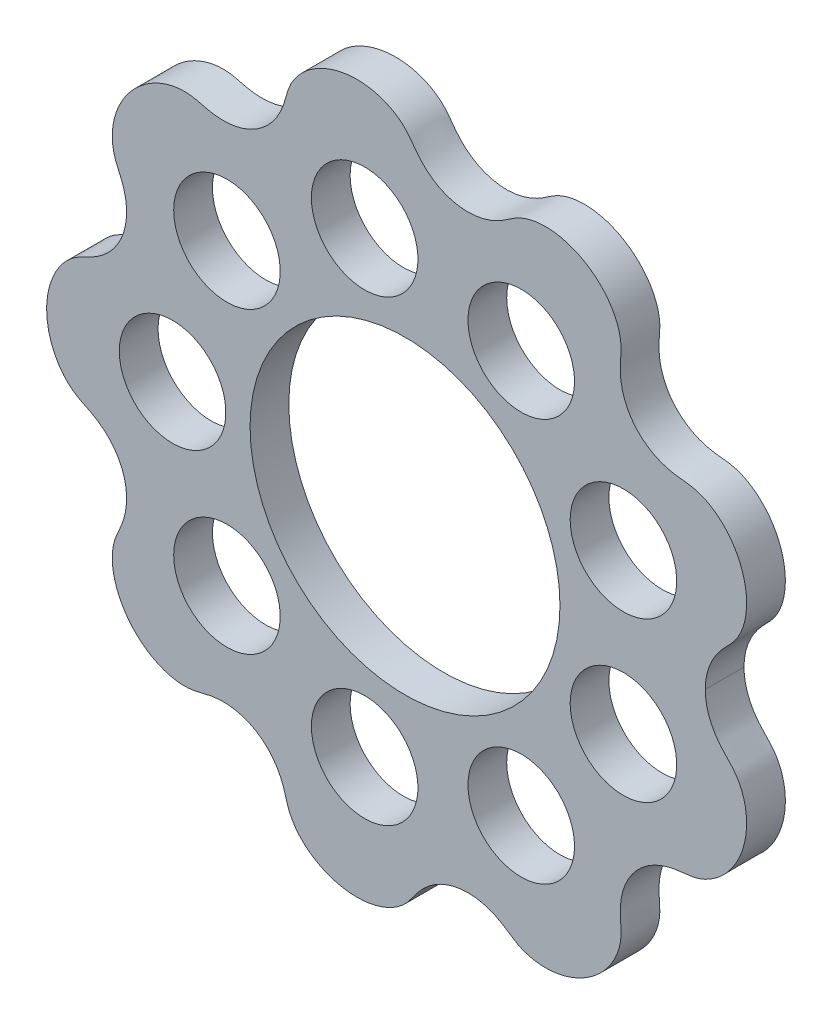
from build123d import *

# Parameters (mm, degrees)
BOSS_EXTRUDE1_DEPTH = 25.4
SKETCH7_R           = 101.6
SKETCH7_R_2         = 34.925
CUT_EXTRUDE1_DEPTH  = 25.4


# Read off the part's stored shape, not the designer's step: Boss-Extrude1
with BuildPart() as part:
    # Boss-Extrude1 outline → Boss-Extrude1 (new body)
    with BuildSketch(Plane.XY):
        with BuildLine():
            add(Edge.make_bspline(
                [(-234.95, 0), (-234.95, -0.220380814), (-234.947590154, -0.544101206), (-234.939557298, -1.173634251), (-234.917868443, -1.91226702), (-234.886540038, -2.647513455), (-234.835931347, -3.560918281), (-234.758812439, -4.554232427), (-234.66240931, -5.575608828), (-234.546722938, -6.57781084), (-234.366267376, -7.92565393), (-234.093541377, -9.600599485), (-233.692246689, -11.603252575), (-233.117303463, -13.915435499), (-232.435862893, -16.199670032), (-231.647877023, -18.448777696), (-230.753201881, -20.657971423), (-229.751815959, -22.820831559), (-228.607728174, -24.998982932), (-227.309240126, -27.179170322), (-225.843658283, -29.344362379), (-224.198718625, -31.475309557), (-221.895502812, -34.083333593), (-219.307150866, -36.502221099), (-216.42131401, -38.658386082), (-212.959565054, -40.660874881), (-209.699147786, -42.209916176), (-206.135389451, -43.92194884), (-202.392724366, -46.045884891), (-198.624789727, -48.640215141), (-194.940225701, -51.792932901), (-191.465795803, -55.562408034), (-188.352803631, -59.976657164), (-185.90367834, -64.657243151), (-184.118738866, -69.501261319), (-182.979459938, -74.409236131), (-182.451431228, -79.296475214), (-182.513191472, -84.659896283), (-183.339948185, -90.417427736), (-184.850125286, -95.641782664), (-186.773705134, -100.304517919), (-188.548098426, -104.122715792), (-189.87011621, -107.240720514), (-190.995728956, -110.838424894), (-191.766448398, -114.917229844), (-192.086281189, -119.768223701), (-191.722634556, -125.327453856), (-190.646015176, -130.794130874), (-188.926233428, -136.088256778), (-186.293506027, -141.987839158), (-182.470856407, -148.289867044), (-177.722742446, -153.948448907), (-172.180252675, -158.80735955), (-166.827466507, -162.424541638), (-161.912407268, -165.037511346), (-156.715734302, -167.047052972), (-151.304107991, -168.370525163), (-146.47127314, -168.897917622), (-142.320600557, -168.84718414), (-138.582092476, -168.363406872), (-135.281891882, -167.602909189), (-131.213579664, -166.518496327), (-126.28765785, -165.433814904), (-120.880429877, -164.853781334), (-115.066807698, -165.039368665), (-109.774138568, -165.909896531), (-105.052848436, -167.27856093), (-100.529470416, -169.205005773), (-96.271060841, -171.663544728), (-92.341132782, -174.61774194), (-88.794988811, -178.022115965), (-85.395117397, -182.170497339), (-82.769632774, -186.399187645), (-80.810250686, -190.541059196), (-79.366128397, -194.480551684), (-78.509646724, -197.296702824), (-77.836042344, -199.73393124), (-77.136746563, -202.173489139), (-76.352173546, -204.588409477), (-75.066111769, -207.67689429), (-73.033988897, -211.296775833), (-70.161261743, -215.218480281), (-66.309018081, -219.243322938), (-61.970542416, -222.739020294), (-57.250018924, -225.689092438), (-51.441085443, -228.516152434), (-44.461916439, -230.886637694), (-35.974888842, -232.383104234), (-27.025092624, -232.304217862), (-19.110063195, -230.898329878), (-12.675498259, -228.700349948), (-7.679059731, -226.23578481), (-3.638240286, -223.533114008), (-0.490614066, -220.826570841), (1.774211393, -218.364194696), (3.337445492, -216.36326664), (4.8288816, -214.309976931), (6.295587765, -212.250175367), (8.063341469, -209.896692496), (10.228399237, -207.329031436), (12.556213731, -204.919941341), (15.345867473, -202.429451623), (18.660528866, -199.963341936), (22.552917091, -197.655770957), (27.049453338, -195.669514548), (31.752841034, -194.237618222), (36.595265683, -193.383793204), (41.504758318, -193.120623175), (46.40941607, -193.449270035), (51.680645069, -194.441444297), (57.207131303, -196.255422708), (62.089885079, -198.649858729), (66.347751494, -201.353889083), (69.799825007, -203.7643493), (72.640893008, -205.60771802), (75.988479884, -207.340965318), (79.871484917, -208.808252527), (84.593241882, -209.965592984), (90.131163367, -210.572820556), (95.701738849, -210.461836881), (101.214077571, -209.687496351), (107.481190909, -208.119220154), (114.351291298, -205.448976142), (120.748376372, -201.755607184), (126.495956475, -197.141050047), (130.987623936, -192.497717887), (134.414501908, -188.111037789), (137.295721354, -183.3423145), (139.539080918, -178.24265142), (140.897247934, -173.574927561), (141.568761391, -169.478319851), (141.720917302, -166.136242006), (141.632262576, -163.598606153), (141.454933268, -161.067023712), (141.2544846, -158.546340167), (141.095870142, -155.607179788), (141.103941465, -152.248563689), (141.338616789, -148.906803936), (141.874759976, -145.205822954), (142.828752947, -141.186050243), (144.327217419, -136.916369279), (146.495022934, -132.504490881), (149.177621774, -128.384315276), (152.338306095, -124.617596834), (155.930033232, -121.260235828), (159.898469164, -118.359340735), (164.574222182, -115.73110957), (169.973759083, -113.568340874), (175.253279309, -112.264011476), (180.253111391, -111.598515413), (184.446967132, -111.226084546), (187.808245982, -110.811984321), (191.486756323, -109.987940219), (195.404464579, -108.616001876), (199.765464718, -106.46748596), (204.39807648, -103.37294736), (208.594046905, -99.70722303), (212.319005314, -95.57079503), (216.111826885, -90.340978276), (219.156475101, -84.793666901), (221.542108754, -78.731559419), (223.15508973, -72.239674436), (223.924979402, -66.644094285), (224.0832738, -60.846628215), (223.615846183, -55.696742755), (222.725196994, -51.247909792), (221.620192633, -47.583658394), (220.556844201, -44.808971953), (219.320513319, -42.189810589), (217.922795316, -39.739047012), (216.40502209, -37.523690695), (214.802636844, -35.54233819), (212.784617945, -33.350567501), (210.37413656, -30.93856682), (208.037205123, -28.452220755), (205.874647298, -25.811318759), (204.339886865, -23.678970834), (203.329191362, -22.137672175), (202.307284236, -20.441465826), (201.293416322, -18.581576948), (200.231424377, -16.349218244), (199.307286607, -14.013227431), (198.618668185, -11.925576805), (198.11547077, -10.109250026), (197.754243941, -8.57967147), (197.452128744, -7.037251128), (197.240023129, -5.678566253), (197.095834551, -4.508644285), (197.000866111, -3.531322991), (196.940041856, -2.748086006), (196.900103207, -2.058826903), (196.875371564, -1.481355606), (196.861100812, -0.978419678), (196.853488972, -0.556541751), (196.850634358, -0.255617983), (196.85, -0.08531086), (196.85, -1e-09)],
                knots=[0.066092855, 0.066092855, 0.066092855, 0.066092855, 0.066092855, 0.067201481, 0.067755795, 0.068310108, 0.069418734, 0.070527361, 0.071635988, 0.072744614, 0.073853241, 0.074961867, 0.077564671, 0.080167474, 0.082770277, 0.085373081, 0.087975884, 0.090578688, 0.093181491, 0.095784295, 0.09872305, 0.101661805, 0.10460056, 0.107539315, 0.113917987, 0.117107324, 0.12029666, 0.124992231, 0.129687803, 0.134383375, 0.139078947, 0.144956429, 0.150833912, 0.156724461, 0.162615011, 0.167973858, 0.173332706, 0.1786889, 0.184045095, 0.191358572, 0.198672049, 0.202368777, 0.206065506, 0.209762235, 0.213458964, 0.218810451, 0.224161939, 0.230949028, 0.237736117, 0.243086386, 0.248436655, 0.259137192, 0.26983773, 0.275187999, 0.280538268, 0.287325357, 0.294112446, 0.299463933, 0.304815421, 0.30851215, 0.312208879, 0.315905607, 0.319602336, 0.326915813, 0.33422929, 0.339585485, 0.344941679, 0.350300527, 0.355659374, 0.361018221, 0.366377069, 0.371733263, 0.377089458, 0.384402935, 0.388059673, 0.391716412, 0.39541314, 0.397261505, 0.399109869, 0.402806598, 0.406503327, 0.411854814, 0.417206302, 0.423993391, 0.43078048, 0.436130749, 0.441481018, 0.452181555, 0.462882093, 0.473582631, 0.48036972, 0.487156809, 0.492508297, 0.497859784, 0.501556513, 0.505253242, 0.507101606, 0.50894997, 0.512646699, 0.516303438, 0.519960176, 0.523616915, 0.527273653, 0.532629848, 0.537986042, 0.54334489, 0.548703737, 0.554062584, 0.559421432, 0.564777626, 0.570133821, 0.577447298, 0.584760775, 0.588457504, 0.592154232, 0.595850961, 0.59954769, 0.604899177, 0.610250665, 0.617037754, 0.623824843, 0.629175112, 0.634525381, 0.645225919, 0.655926456, 0.661276725, 0.666626994, 0.673414083, 0.680201172, 0.68555266, 0.690904147, 0.694600876, 0.698297605, 0.700145969, 0.701994333, 0.705691062, 0.709347801, 0.713004539, 0.716661278, 0.720318016, 0.725674211, 0.731030405, 0.736389253, 0.7417481, 0.747106947, 0.752465795, 0.757821989, 0.763178184, 0.770491661, 0.777805138, 0.781501867, 0.785198595, 0.788895324, 0.792592053, 0.797943541, 0.803295028, 0.810082117, 0.816869206, 0.822219475, 0.827569744, 0.838270282, 0.844429047, 0.850587812, 0.856746577, 0.862905342, 0.869720711, 0.873128396, 0.876536081, 0.879615122, 0.882694164, 0.885773205, 0.888852246, 0.891335996, 0.893819745, 0.898787243, 0.903754742, 0.906238491, 0.90872224, 0.910264391, 0.911806542, 0.914890845, 0.917975147, 0.921059449, 0.922776075, 0.924492702, 0.926209328, 0.927925955, 0.929642581, 0.930500894, 0.931359207, 0.932217521, 0.933075834, 0.93350499, 0.933934147, 0.934363303, 0.93479246, 0.93479246, 0.93479246, 0.93479246, 0.93479246], degree=4))
            add(Edge.make_bspline(
                [(196.85, -1e-09), (196.85, 0.077725435), (196.850526565, 0.233079521), (196.852896108, 0.502476398), (196.859214569, 0.88650284), (196.871060687, 1.350264945), (196.891590978, 1.877999563), (196.924746696, 2.502596989), (196.975245856, 3.21845277), (197.054102872, 4.108904321), (197.173853099, 5.176457153), (197.35006315, 6.416645175), (197.601177393, 7.826473024), (197.901611406, 9.226392944), (198.250684136, 10.614324008), (198.647729538, 11.988426064), (199.091997825, 13.34723341), (199.582654491, 14.689144816), (200.253204408, 16.344500352), (201.14756006, 18.292779542), (202.257411513, 20.391156432), (203.61416906, 22.612359137), (205.019979569, 24.648727281), (206.447192589, 26.511247314), (207.957990978, 28.306388856), (209.538466736, 30.040132835), (211.167921371, 31.727496869), (212.813150748, 33.399077613), (214.506527263, 35.202663705), (216.168477966, 37.206509241), (217.737306972, 39.443291707), (219.177191452, 41.913828444), (220.444755794, 44.546305145), (221.531444229, 47.325553325), (222.658475008, 50.979681553), (223.578225582, 55.428993282), (224.077265339, 60.604817222), (223.943873435, 66.454112842), (223.179991845, 72.127866747), (221.807569918, 77.685462367), (219.849708981, 83.064640827), (217.328691653, 88.204182218), (214.266840162, 93.04154278), (210.609169514, 97.608107153), (206.899927463, 101.252239606), (203.335395059, 104.069408956), (200.123211258, 106.144187642), (197.504292931, 107.574713564), (194.841159642, 108.776517921), (192.150112418, 109.743545884), (189.510545887, 110.448550463), (186.94936684, 110.915382998), (184.492849653, 111.208379183), (182.158046289, 111.431624706), (179.242006339, 111.737602666), (175.758094468, 112.240635761), (171.493181317, 113.181443556), (166.55509645, 114.857313992), (161.629279523, 117.255174871), (156.864323976, 120.453348678), (152.59075385, 124.28880432), (148.897684442, 128.690033054), (145.862595654, 133.56469793), (143.54043514, 138.812620149), (142.034362289, 144.079987021), (141.241441529, 149.23406313), (141.055521115, 153.597552226), (141.16510517, 157.115886428), (141.370140727, 160.040757694), (141.555721154, 162.378856327), (141.693745973, 164.848931751), (141.678749746, 167.452265353), (141.44281169, 170.174153697), (140.957770499, 172.992240513), (140.236672497, 175.823605956), (139.282649868, 178.651145253), (137.797181604, 182.174810293), (135.641785927, 186.174385782), (132.697119186, 190.46007304), (128.835078982, 194.855151085), (124.602893803, 198.710484937), (119.979203538, 202.085674476), (115.021726068, 204.947875427), (109.786881052, 207.264513887), (104.331971406, 209.00202684), (98.594702066, 210.149112744), (93.410854658, 210.556425319), (88.869422841, 210.423264986), (85.075105271, 209.947885719), (82.149373094, 209.360323903), (79.336789692, 208.56913037), (76.653734325, 207.580144955), (74.178540844, 206.423529133), (71.916489697, 205.134849446), (69.84635404, 203.780278734), (67.914291441, 202.450512053), (65.4837964, 200.810510419), (62.49162163, 198.956440743), (58.619769016, 196.935707996), (53.759747793, 195.045359463), (48.445037845, 193.715973377), (42.73912363, 193.103062263), (36.999995618, 193.294193818), (31.341885022, 194.291871376), (25.883497938, 196.075163849), (20.731320402, 198.602649497), (16.191803503, 201.669601651), (12.271414698, 205.108173374), (9.324194672, 208.331292611), (7.146599297, 211.096932247), (5.423594636, 213.469307943), (4.062856659, 215.379684207), (2.580855928, 217.360592403), (0.895977568, 219.345222254), (-1.034357571, 221.278651636), (-3.217351968, 223.125652914), (-5.589711711, 224.831091816), (-8.138042671, 226.383878658), (-11.540945608, 228.128322086), (-15.762952057, 229.80671303), (-20.773484319, 231.196944642), (-26.557080468, 232.081298164), (-32.277283238, 232.314259043), (-37.988765488, 231.92775342), (-43.626200864, 230.933721461), (-49.125431297, 229.343475965), (-54.420986316, 227.168139775), (-59.55332222, 224.359012913), (-63.786195197, 221.338919563), (-67.179539992, 218.317736728), (-69.780587979, 215.51463476), (-71.6441514, 213.183911904), (-73.290145886, 210.769928732), (-74.70977797, 208.287687205), (-75.862427862, 205.810644381), (-76.766912238, 203.369440017), (-77.482026884, 201.0011211), (-78.107315156, 198.740554823), (-78.915009646, 195.921948588), (-80.015375486, 192.578315947), (-81.682484693, 188.541565968), (-84.19038433, 183.969513554), (-87.407175447, 179.534915026), (-91.384187655, 175.397706914), (-95.903471772, 171.855081803), (-100.879130725, 168.982383767), (-106.206776125, 166.83988147), (-111.778209556, 165.464291923), (-117.227080095, 164.895768361), (-122.440543451, 165.009889773), (-126.770026085, 165.584505838), (-130.215879813, 166.303377387), (-133.060711661, 167.013196558), (-135.33106362, 167.601964168), (-137.739645289, 168.166816176), (-140.306032472, 168.604111912), (-143.027539429, 168.844409236), (-145.887039693, 168.856092551), (-148.800607686, 168.637611097), (-151.7508546, 168.189079261), (-155.478936107, 167.338056612), (-159.792029589, 165.909925233), (-164.523943641, 163.754196379), (-169.522886818, 160.714026537), (-174.05456073, 157.215609457), (-178.181368944, 153.248258949), (-181.86094356, 148.863112681), (-185.051408374, 144.110076771), (-187.70975972, 139.039755418), (-189.835685178, 133.588837467), (-191.136975415, 128.554473435), (-191.794449446, 124.058913123), (-191.985168589, 120.239691019), (-191.914581218, 117.256378249), (-191.623807675, 114.349134994), (-191.115754846, 111.535105751), (-190.406523455, 108.896671792), (-189.530222767, 106.445209405), (-188.555706312, 104.171305025), (-187.581640925, 102.037683236), (-186.388605636, 99.359329582), (-185.08228914, 96.090656849), (-183.764596014, 91.926729819), (-182.746899953, 86.812287658), (-182.360599924, 81.347474629), (-182.747821915, 75.621815168), (-183.93263887, 70.003067062), (-185.897680063, 64.604160755), (-188.601719278, 59.538364347), (-191.985472994, 54.903353203), (-195.794110067, 50.965372483), (-199.861210572, 47.701644791), (-203.547142692, 45.358888664), (-206.648901665, 43.694623729), (-209.284432003, 42.40975481), (-211.402075521, 41.401421506), (-213.610235121, 40.285919207), (-215.857291423, 38.971261484), (-218.096544715, 37.405994838), (-220.294562167, 35.576884418), (-222.386042444, 33.536726589), (-224.357760123, 31.2967269), (-226.197272225, 28.868105842), (-227.680571922, 26.587771333), (-228.838232661, 24.564778465), (-229.712924972, 22.866098012), (-230.353106786, 21.51946934), (-230.939512647, 20.182626052), (-231.475015892, 18.858196158), (-231.972172505, 17.518910878), (-232.431005555, 16.166019427), (-232.851533091, 14.800739933), (-233.233773882, 13.424256259), (-233.577743789, 12.037711848), (-233.883457864, 10.642245857), (-234.15092905, 9.238933486), (-234.380168906, 7.82890188), (-234.547309887, 6.590108362), (-234.666690215, 5.525438524), (-234.750253597, 4.636670276), (-234.807552883, 3.924013886), (-234.855301359, 3.213993237), (-234.888724759, 2.58481279), (-234.911404702, 2.052314502), (-234.926325625, 1.615939534), (-234.935874978, 1.257743787), (-234.944827467, 0.783046674), (-234.948806337, 0.389084925), (-234.95, 0.155103005), (-234.95, 0)],
                knots=[0.065207541, 0.065207541, 0.065207541, 0.065207541, 0.065207541, 0.065598539, 0.065989537, 0.066380535, 0.066771533, 0.067553529, 0.068335526, 0.069117522, 0.069899518, 0.07146351, 0.073027503, 0.074591495, 0.076155487, 0.07771948, 0.079280136, 0.080840792, 0.082401448, 0.083962103, 0.087083415, 0.090204727, 0.092767212, 0.095329696, 0.09789218, 0.100454664, 0.103017148, 0.105579633, 0.108142117, 0.110704601, 0.113825178, 0.116945755, 0.120066332, 0.123186909, 0.126580642, 0.129974374, 0.13676184, 0.14300381, 0.14924578, 0.15548775, 0.161729719, 0.167971689, 0.174213659, 0.180455629, 0.186697599, 0.193485064, 0.196878797, 0.20027253, 0.203393107, 0.206513684, 0.209634261, 0.212754838, 0.215317322, 0.217879806, 0.22044229, 0.223004775, 0.228129743, 0.233254711, 0.239497335, 0.245739959, 0.251995929, 0.258251898, 0.264507867, 0.270763837, 0.27700646, 0.283249084, 0.288374053, 0.293499021, 0.296061505, 0.298623989, 0.301186474, 0.303748958, 0.306869535, 0.309990112, 0.313110689, 0.316231266, 0.319624998, 0.323018731, 0.329806197, 0.336048167, 0.342290137, 0.348532107, 0.354774076, 0.361016046, 0.367258016, 0.373499986, 0.379741956, 0.386529421, 0.389923154, 0.393316887, 0.396437464, 0.399558041, 0.402678618, 0.405799195, 0.408361679, 0.410924163, 0.413486647, 0.416049132, 0.4211741, 0.426299068, 0.432541692, 0.438784316, 0.445040285, 0.451296255, 0.457552224, 0.463808193, 0.470050817, 0.476293441, 0.48141841, 0.486543378, 0.489105862, 0.491668346, 0.494230831, 0.496793315, 0.499913892, 0.503034469, 0.506155046, 0.509275623, 0.512669355, 0.516063088, 0.522850554, 0.529092524, 0.535334494, 0.541576463, 0.547818433, 0.554060403, 0.560302373, 0.566544343, 0.572786313, 0.579573778, 0.582967511, 0.586361244, 0.589481821, 0.592602398, 0.595722975, 0.598843552, 0.601406036, 0.60396852, 0.606531004, 0.609093489, 0.614218457, 0.619343425, 0.625586049, 0.631828673, 0.638084642, 0.644340612, 0.650596581, 0.65685255, 0.663095174, 0.669337798, 0.674462767, 0.679587735, 0.682150219, 0.684712703, 0.687275188, 0.689837672, 0.692958249, 0.696078826, 0.699199403, 0.702319979, 0.705713712, 0.709107445, 0.715894911, 0.722136881, 0.728378851, 0.73462082, 0.74086279, 0.74710476, 0.75334673, 0.7595887, 0.765830669, 0.772618135, 0.776011868, 0.779405601, 0.782526178, 0.785646755, 0.788767332, 0.791887909, 0.794450393, 0.797012877, 0.799575361, 0.802137845, 0.807262814, 0.812387782, 0.818630406, 0.82487303, 0.831128999, 0.837384969, 0.843640938, 0.849896907, 0.856139531, 0.862382155, 0.867507123, 0.872632092, 0.875194576, 0.87775706, 0.880319544, 0.882882029, 0.886002606, 0.889123183, 0.892243759, 0.895364336, 0.898758069, 0.902151802, 0.905545535, 0.907242401, 0.908939268, 0.91049976, 0.912060253, 0.913620745, 0.915181238, 0.91674173, 0.918302223, 0.919862715, 0.921423208, 0.9229837, 0.924544192, 0.926104685, 0.927665177, 0.928445424, 0.92922567, 0.930005916, 0.930786162, 0.931566408, 0.931956532, 0.932346655, 0.932736778, 0.933126901, 0.933907147, 0.933907147, 0.933907147, 0.933907147, 0.933907147], degree=4))
        make_face()
    extrude(amount=BOSS_EXTRUDE1_DEPTH)

    # Sketch7 → Cut-Extrude1 (cut)
    with BuildSketch(Plane(origin=(0, 0, 0), x_dir=(-1, 0, 0), z_dir=(0, 0, -1))):
        Circle(SKETCH7_R)
        with Locations((-143.209145386, -52.123897376)):
            Circle(SKETCH7_R_2)
        with Locations((-143.209165429, 52.123842309)):
            Circle(SKETCH7_R_2)
        with Locations((-76.200025375, 131.982256886)):
            Circle(SKETCH7_R_2)
        with Locations((26.463953421, 150.084706647)):
            Circle(SKETCH7_R_2)
        with Locations((116.745154297, 97.960854162)):
            Circle(SKETCH7_R_2)
        with Locations((152.4, 2.9301e-05)):
            Circle(SKETCH7_R_2)
        with Locations((116.745191965, -97.960809271)):
            Circle(SKETCH7_R_2)
        with Locations((26.464011132, -150.084696471)):
            Circle(SKETCH7_R_2)
        with Locations((-76.199974625, -131.982286187)):
            Circle(SKETCH7_R_2)
    extrude(amount=-CUT_EXTRUDE1_DEPTH, mode=Mode.SUBTRACT)


solid = part.part
